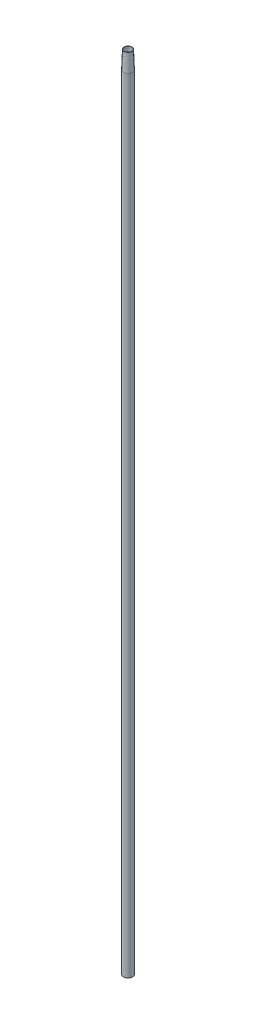
from build123d import *

# Parameters (mm, degrees)
SKETCH1_R           = 2.555
SKETCH1_R_2         = 2.055
BOSS_EXTRUDE1_DEPTH = 450
CHAMFER1_SIZE       = 10
CHAMFER1_SIZE2      = 0.349207695


with BuildPart() as part:
    # Sketch1 → Boss-Extrude1 (new body)
    with BuildSketch(Plane(origin=(0, 0, 0), x_dir=(1, 0, 0), z_dir=(0, 1, 0))):
        Circle(SKETCH1_R)
        Circle(SKETCH1_R_2, mode=Mode.SUBTRACT)
    extrude(amount=BOSS_EXTRUDE1_DEPTH)

    # Chamfer1
    chamfer1_edges = [part.edges().sort_by_distance(p)[0] for p in [
        (-2.555, 450, 0),
    ]]
    chamfer1_side = [part.faces().sort_by_distance(p)[0] for p in [
        (-2.555, 225, 0),
    ]]
    chamfer(chamfer1_edges, length=CHAMFER1_SIZE, length2=CHAMFER1_SIZE2, reference=chamfer1_side[0])


solid = part.part
